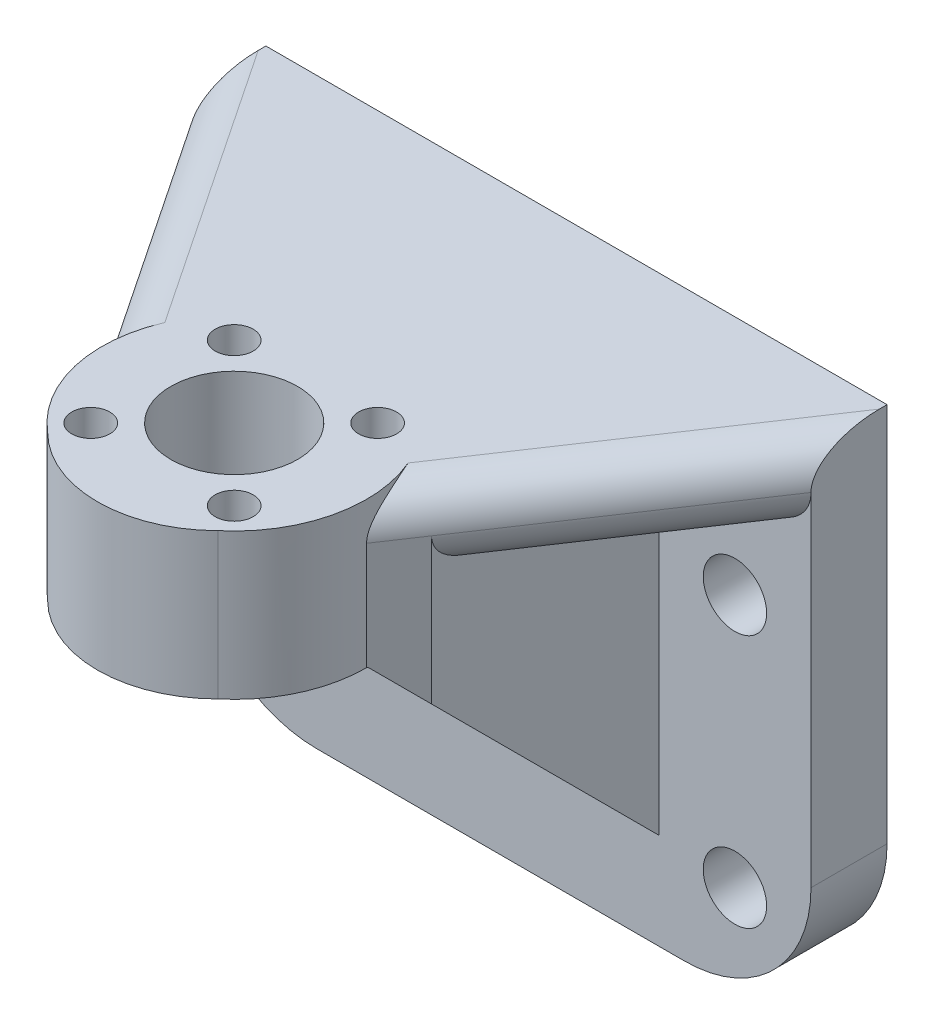
from build123d import *

# Parameters (mm, degrees)
SKETCH_1_W           = 49
SKETCH_1_H           = 35
EXTRUDE_1_DEPTH      = 40
SKETCH_2_R           = 5
SKETCH_2_R_2         = 1.5
CUT_EXTRUDE_1_DEPTH  = 40
SKETCH_3_W           = 12
SKETCH_3_H           = 34
CUT_EXTRUDE_3_DEPTH  = 29
CUT_EXTRUDE_6_DEPTH  = 50
SKETCH_7_W           = 21
SKETCH_7_H           = 28.5
CUT_EXTRUDE_8_DEPTH  = 29
CUT_EXTRUDE_10_DEPTH = 29
SKETCH_12_R          = 2.5
CUT_EXTRUDE_12_DEPTH = 56.14752941
FILLET_1_R           = 10
FILLET_2_R           = 10
FILLET_4_R           = 3
EXTRUDE_2_DEPTH      = 11.5


with BuildPart() as part:
    # 草圖1 → 填料-伸長1 (new body)
    with BuildSketch(Plane(origin=(0, 0, 0), x_dir=(1, 0, 0), z_dir=(0, 1, 0))):
        Rectangle(SKETCH_1_W, SKETCH_1_H)
    extrude(amount=EXTRUDE_1_DEPTH)

    # 草圖2 → 除料-伸長1 (cut)
    with BuildSketch(Plane(origin=(0, 40, 0), x_dir=(1, 0, 0), z_dir=(0, 1, 0))):
        with Locations(Location((0, -9.5, 0), (0, 0, 270))):
            Circle(SKETCH_2_R)
        with Locations(Location((5.656854249, -3.843145751, 0), (0, 0, 270))):
            Circle(SKETCH_2_R_2)
        with Locations(Location((5.656854249, -15.156854249, 0), (0, 0, 90))):
            Circle(SKETCH_2_R_2)
        with Locations(Location((-5.656854249, -15.156854249, 0), (0, 0, 270))):
            Circle(SKETCH_2_R_2)
        with Locations(Location((-5.656854249, -3.843145751, 0), (0, 0, 90))):
            Circle(SKETCH_2_R_2)
    extrude(amount=-CUT_EXTRUDE_1_DEPTH, mode=Mode.SUBTRACT)

    # 草圖3 → 除料-伸長3 (cut)
    with BuildSketch(Plane.XY.offset(17.5)):
        with Locations((-18.5, 17)):
            Rectangle(SKETCH_3_W, SKETCH_3_H)
        with Locations((18.5, 17)):
            Rectangle(SKETCH_3_W, SKETCH_3_H)
    extrude(amount=-CUT_EXTRUDE_3_DEPTH, mode=Mode.SUBTRACT)

    # 草圖6 → 除料-伸長6 (cut)
    with BuildSketch(Plane(origin=(0, 40, 0), x_dir=(1, 0, 0), z_dir=(0, 1, 0))):
        with BuildLine():
            Line((-10.444900063, -9.5), (-24.5, 11.5))
            Line((-24.5, 11.5), (-24.5, -17.5))
            Line((-24.5, -17.5), (-6.715350871, -17.5))
            ThreePointArc((-6.715350871, -17.5), (-9.466707613, -13.913318966), (-10.444900063, -9.5))
        make_face()
        with BuildLine():
            Line((24.5, 11.5), (10.444900063, -9.5))
            ThreePointArc((10.444900063, -9.5), (9.466707613, -13.913318966), (6.715350871, -17.5))
            Line((6.715350871, -17.5), (24.5, -17.5))
            Line((24.5, -17.5), (24.5, 11.5))
        make_face()
    extrude(amount=-CUT_EXTRUDE_6_DEPTH, mode=Mode.SUBTRACT)

    # 草圖7 → 除料-伸長8 (cut)
    with BuildSketch(Plane.XY.offset(17.5)):
        with Locations((0, 14.25)):
            Rectangle(SKETCH_7_W, SKETCH_7_H)
    extrude(amount=-CUT_EXTRUDE_8_DEPTH, mode=Mode.SUBTRACT)

    # 草圖10 → 除料-伸長10 (cut)
    with BuildSketch(Plane.ZY.offset(12.5)):
        Polygon((-11.5, 0), (6.429434947, 0), (9.417674105, 0), (9.417674105, 28.5), (-11.5, 7.582325895), align=None)
    extrude(amount=-CUT_EXTRUDE_10_DEPTH, mode=Mode.SUBTRACT)

    # 草圖12 → 除料-伸長12 (cut, through all)
    with BuildSketch(Plane.XY.offset(-11.5)):
        with Locations((18.5, 7)):
            Circle(SKETCH_12_R)
        with Locations((18.5, 27)):
            Circle(SKETCH_12_R)
        with Locations((-18.5, 7)):
            Circle(SKETCH_12_R)
        with Locations((-18.5, 27)):
            Circle(SKETCH_12_R)
    extrude(amount=-CUT_EXTRUDE_12_DEPTH, mode=Mode.SUBTRACT)

    # 圓角1
    fillet_1_edges = [part.edges().sort_by_distance(p)[0] for p in [
        (-24.5, 0, -14.5),
    ]]
    fillet(fillet_1_edges, radius=FILLET_1_R)

    # 圓角2
    fillet_2_edges = [part.edges().sort_by_distance(p)[0] for p in [
        (24.5, 0, -14.5),
    ]]
    fillet(fillet_2_edges, radius=FILLET_2_R)

    # 圓角4
    fillet_4_edges = [part.edges().sort_by_distance(p)[0] for p in [
        (-18.5, 34, -2.535282526),
        (-17.472450031, 40, -1),
        (17.472450031, 40, -1),
        (18.5, 34, -2.535282526),
    ]]
    fillet(fillet_4_edges, radius=FILLET_4_R - 0.0001)  # a hair under: the kernel refuses the full size

    # 草圖14 → 填料-伸長2 (add)
    with BuildSketch(Plane(origin=(0, 40, 0), x_dir=(1, 0, 0), z_dir=(0, 1, 0))):
        with BuildLine():
            Line((-6.715350871, -17.5), (6.715350871, -17.5))
            ThreePointArc((6.715350871, -17.5), (0, -20.281589407), (-6.715350871, -17.5))
        make_face()
    extrude(amount=-EXTRUDE_2_DEPTH)


solid = part.part
